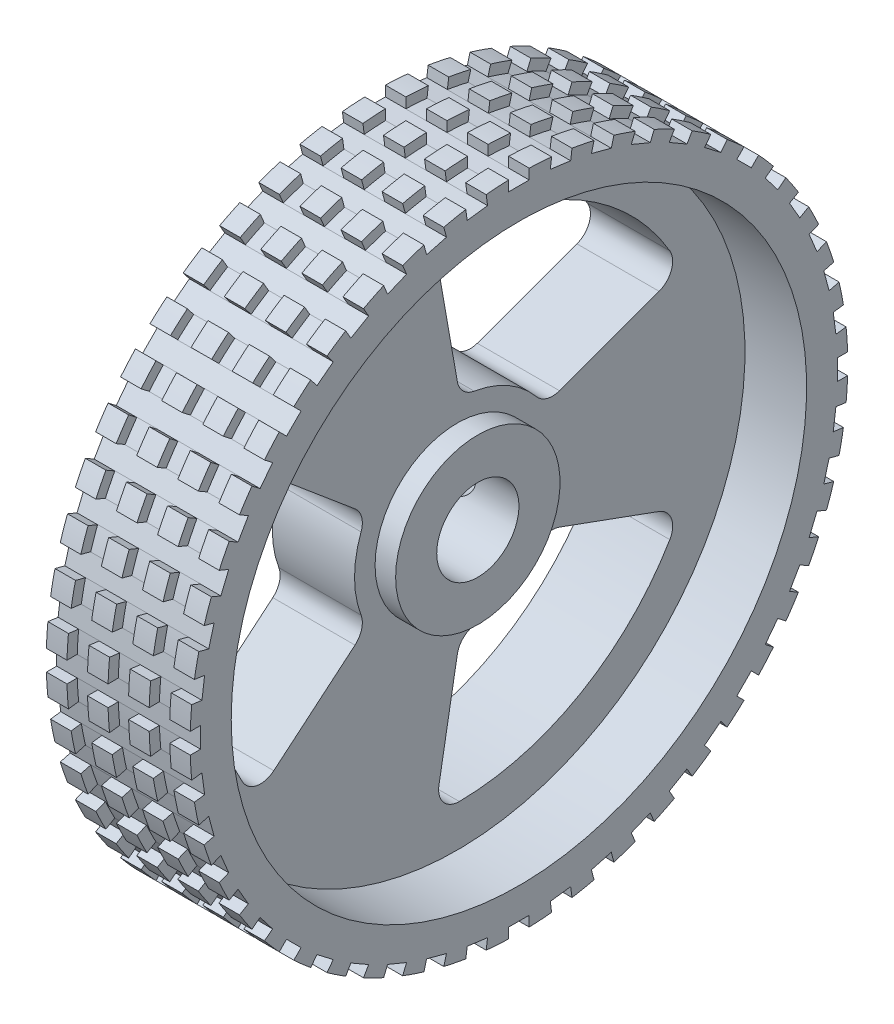
from build123d import *

# Parameters (mm, degrees)
CUT_EXTRUDE1_DEPTH       = 23.978250743
FILLET1_R                = 1
CIRPATTERN1_COUNT        = 3
FILLET1_OF_CIRPATTERN1_R = 1
SKETCH5_W                = 1
SKETCH5_H                = 0.5
SKETCH8_W                = 0.5
SKETCH8_H                = 1
CUT_EXTRUDE8_DEPTH       = 24.685438729
CIRPATTERN2_DEPTH        = 7
LPATTERN1_COUNT          = 3
LPATTERN1_PITCH          = 2


# Read off the part's stored shape, not the designer's step: CirPattern2
with BuildPart() as part:
    # Sketch1 → Revolve1 (revolve)
    with BuildSketch(Plane(origin=(0, 0, 0), x_dir=(1, 0, 0), z_dir=(0, 1, 0)), mode=Mode.PRIVATE) as revolve1_sk:
        Polygon((0, 16), (7, 16), (7, 14), (4, 14), (4, 4), (5, 4), (5, 2), (0, 2), align=None)
    revolve(revolve1_sk.sketch.rotate(Axis((0, 0, 0), (1, 0, 0)), 180), axis=Axis((0, 0, 0), (1, 0, 0)))

    # Sketch3 → countersunk (revolve, cut)
    with BuildSketch(Plane(origin=(0, 0, 0), x_dir=(1, 0, 0), z_dir=(0, 1, 0))):
        Polygon((2, 16), (3.5, 16), (3.5, 11.5), (2.9, 11.5), (2.9, 0), (2, 0), align=None)
    revolve(axis=Axis((2, 0, 1.061944764), (0, 0, -1)), mode=Mode.SUBTRACT)

    # Sketch4 → Cut-Extrude1 (cut, through all)
    with BuildSketch(Plane(origin=(4, 0, 0), x_dir=(0, 0, -1), z_dir=(1, 0, 0))):
        with BuildLine():
            Line((-1.091722433, 11.95023607), (0.134108893, 4.998201157))
            ThreePointArc((0.134108893, 4.998201157), (2.5, 4.330127019), (4.261514729, 2.615242287))
            Line((4.261514729, 2.615242287), (10.895069234, 5.029658674))
            ThreePointArc((10.895069234, 5.029658674), (6, 10.392304845), (-1.091722433, 11.95023607))
        make_face()
    cut_extrude1 = extrude(amount=-CUT_EXTRUDE1_DEPTH, mode=Mode.SUBTRACT)

    # Fillet1
    fillet1_edges = [part.edges().sort_by_distance(p)[0] for p in [
        (2, 11.95023607, 1.091722433),
        (2, 5.029658674, -10.895069234),
        (2, 2.615242287, -4.261514729),
        (2, 4.998201157, -0.134108893),
    ]]
    fillet(fillet1_edges, radius=FILLET1_R)

    # CirPattern1: Cut-Extrude1 ×3 about axis
    cirpattern1_axis = Axis((0, 0, 0), (1, 0, 0))
    for i in range(1, CIRPATTERN1_COUNT):
        add(cut_extrude1.rotate(cirpattern1_axis, i * 360 / CIRPATTERN1_COUNT), mode=Mode.SUBTRACT)

    # Fillet1 of CirPattern1
    fillet1_of_cirpattern1_edges = [part.edges().sort_by_distance(p)[0] for p in [
        (2, -6.920577396, 9.803346801),
        (2, 6.920577396, 9.803346801),
        (2, 2.38295887, 4.395623622),
        (2, -2.38295887, 4.395623622),
        (2, -5.029658674, -10.895069234),
        (2, -11.95023607, 1.091722433),
        (2, -4.998201157, -0.134108893),
        (2, -2.615242287, -4.261514729),
    ]]
    fillet(fillet1_of_cirpattern1_edges, radius=FILLET1_OF_CIRPATTERN1_R)

    # Sketch5 → Cut-Revolve1 (revolve, cut)
    with BuildSketch(Plane(origin=(0, 0, 0), x_dir=(1, 0, 0), z_dir=(0, 1, 0)), mode=Mode.PRIVATE) as cut_revolve1_sk:
        with Locations((5.5, 15.75)):
            Rectangle(SKETCH5_W, SKETCH5_H)
    cut_revolve1 = revolve(cut_revolve1_sk.sketch.rotate(Axis((0, 0, 0), (1, 0, 0)), 180), axis=Axis((0, 0, 0), (1, 0, 0)), mode=Mode.SUBTRACT)

    # Sketch8 → Cut-Extrude8 (cut, through all)
    with BuildSketch(Plane(origin=(7, 0, 0), x_dir=(0, 0, -1), z_dir=(1, 0, 0))):
        with Locations((15.742185592, 0)):
            Rectangle(SKETCH8_W, SKETCH8_H)
    extrude(amount=-CUT_EXTRUDE8_DEPTH, mode=Mode.SUBTRACT)


with BuildPart() as cut_extrude8_kept_piece:
    # of the separate pieces the step leaves, the one the design keeps (cut_extrude8_pieces_kept)
    add(part.part.solids().sort_by_distance((0, 0.5, -15.492185592))[0])

    # CirPattern2 outline → CirPattern2 (cut)
    with BuildSketch(Plane.YZ):
        with BuildLine():
            Line((0.5, 15.492185592), (0.5, 15.992185592))
            ThreePointArc((0.5, 15.992185592), (0, 16), (-0.5, 15.992185592))
            Line((-0.5, 15.992185592), (-0.5, 15.492185592))
            Line((-0.5, 15.492185592), (0.5, 15.492185592))
        make_face()
        with BuildLine():
            ThreePointArc((2.583121521, 15.790107132), (2.088419076, 15.863117783), (1.59167666, 15.920633324))
            Line((1.59167666, 15.920633324), (1.526413564, 15.424910892))
            Line((1.526413564, 15.424910892), (2.517858425, 15.2943847))
            Line((2.517858425, 15.2943847), (2.583121521, 15.790107132))
        make_face()
        with BuildLine():
            Line((-1.526413564, 15.424910892), (-1.59167666, 15.920633323))
            ThreePointArc((-1.59167666, 15.920633323), (-2.088419075, 15.863117781), (-2.583121521, 15.79010713))
            Line((-2.583121521, 15.79010713), (-2.517858425, 15.2943847))
            Line((-2.517858425, 15.2943847), (-1.526413564, 15.424910892))
        make_face()
        with BuildLine():
            ThreePointArc((4.622045117, 15.317855561), (4.141104722, 15.454813222), (3.656119291, 15.576674605))
            Line((3.656119291, 15.576674605), (3.526709768, 15.093711691))
            Line((3.526709768, 15.093711691), (4.492635595, 14.834892646))
            Line((4.492635595, 14.834892646), (4.622045117, 15.317855561))
        make_face()
        with BuildLine():
            Line((-3.526709768, 15.093711691), (-3.656119291, 15.576674603))
            ThreePointArc((-3.656119291, 15.576674603), (-4.141104721, 15.454813219), (-4.622045117, 15.317855558))
            Line((-4.622045117, 15.317855558), (-4.492635595, 14.834892646))
            Line((-4.492635595, 14.834892646), (-3.526709768, 15.093711691))
        make_face()
        with BuildLine():
            ThreePointArc((6.581884241, 14.583511234), (6.122934919, 14.782072522), (5.658004708, 14.966194666))
            Line((5.658004708, 14.966194666), (5.466662991, 14.504254898))
            Line((5.466662991, 14.504254898), (6.390542523, 14.121571466))
            Line((6.390542523, 14.121571466), (6.581884241, 14.583511234))
        make_face()
        with BuildLine():
            Line((-5.466662991, 14.504254898), (-5.658004707, 14.966194663))
            ThreePointArc((-5.658004707, 14.966194663), (-6.122934917, 14.782072518), (-6.581884239, 14.58351123))
            Line((-6.581884239, 14.58351123), (-6.390542523, 14.121571466))
            Line((-6.390542523, 14.121571466), (-5.466662991, 14.504254898))
        make_face()
        with BuildLine():
            ThreePointArc((8.429105499, 13.599638986), (8.000000001, 13.856406462), (7.563080095, 14.099638986))
            Line((7.563080095, 14.099638986), (7.313080094, 13.666626283))
            Line((7.313080094, 13.666626283), (8.179105498, 13.166626283))
            Line((8.179105498, 13.166626283), (8.429105499, 13.599638986))
        make_face()
        with BuildLine():
            Line((-7.313080094, 13.666626283), (-7.563080093, 14.099638982))
            ThreePointArc((-7.563080093, 14.099638982), (-7.999999999, 13.856406458), (-8.429105497, 13.599638982))
            Line((-8.429105497, 13.599638982), (-8.179105498, 13.166626283))
            Line((-8.179105498, 13.166626283), (-7.313080094, 13.666626283))
        make_face()
        with BuildLine():
            ThreePointArc((10.132102426, 12.383073145), (9.740182866, 12.693653447), (9.338749086, 12.991834574))
            Line((9.338749086, 12.991834574), (9.034368369, 12.595157902))
            Line((9.034368369, 12.595157902), (9.827721709, 11.986396473))
            Line((9.827721709, 11.986396473), (10.132102426, 12.383073145))
        make_face()
        with BuildLine():
            Line((-9.034368369, 12.595157902), (-9.338749082, 12.99183457))
            ThreePointArc((-9.338749082, 12.99183457), (-9.740182863, 12.693653442), (-10.132102422, 12.383073141))
            Line((-10.132102422, 12.383073141), (-9.827721709, 11.986396473))
            Line((-9.827721709, 11.986396473), (-9.034368369, 12.595157902))
        make_face()
        with BuildLine():
            ThreePointArc((11.661736271, 10.95462949), (11.313708501, 11.313708501), (10.95462949, 11.661736271))
            Line((10.95462949, 11.661736271), (10.601076097, 11.308182878))
            Line((10.601076097, 11.308182878), (11.308182878, 10.601076097))
            Line((11.308182878, 10.601076097), (11.661736271, 10.95462949))
        make_face()
        with BuildLine():
            Line((-10.601076097, 11.308182878), (-10.954629485, 11.661736266))
            ThreePointArc((-10.954629485, 11.661736266), (-11.313708497, 11.313708497), (-11.661736266, 10.954629485))
            Line((-11.661736266, 10.954629485), (-11.308182878, 10.601076097))
            Line((-11.308182878, 10.601076097), (-10.601076097, 11.308182878))
        make_face()
        with BuildLine():
            ThreePointArc((12.991834575, 9.338749086), (12.693653447, 9.740182867), (12.383073146, 10.132102426))
            Line((12.383073146, 10.132102426), (11.986396473, 9.827721709))
            Line((11.986396473, 9.827721709), (12.595157902, 9.034368369))
            Line((12.595157902, 9.034368369), (12.991834575, 9.338749086))
        make_face()
        with BuildLine():
            Line((-11.986396473, 9.827721709), (-12.38307314, 10.132102422))
            ThreePointArc((-12.38307314, 10.132102422), (-12.693653442, 9.740182862), (-12.991834569, 9.338749082))
            Line((-12.991834569, 9.338749082), (-12.595157902, 9.034368369))
            Line((-12.595157902, 9.034368369), (-11.986396473, 9.827721709))
        make_face()
        with BuildLine():
            ThreePointArc((14.099638988, 7.563080096), (13.856406464, 8.000000002), (13.599638988, 8.4291055))
            Line((13.599638988, 8.4291055), (13.166626283, 8.179105498))
            Line((13.166626283, 8.179105498), (13.666626283, 7.313080094))
            Line((13.666626283, 7.313080094), (14.099638988, 7.563080096))
        make_face()
        with BuildLine():
            Line((-13.166626283, 8.179105498), (-13.599638981, 8.429105496))
            ThreePointArc((-13.599638981, 8.429105496), (-13.856406457, 7.999999998), (-14.099638981, 7.563080092))
            Line((-14.099638981, 7.563080092), (-13.666626283, 7.313080094))
            Line((-13.666626283, 7.313080094), (-13.166626283, 8.179105498))
        make_face()
        with BuildLine():
            ThreePointArc((14.966194668, 5.658004709), (14.782072524, 6.12293492), (14.583511236, 6.581884242))
            Line((14.583511236, 6.581884242), (14.121571466, 6.390542523))
            Line((14.121571466, 6.390542523), (14.504254898, 5.466662991))
            Line((14.504254898, 5.466662991), (14.966194668, 5.658004709))
        make_face()
        with BuildLine():
            Line((-14.121571466, 6.390542523), (-14.583511228, 6.581884238))
            ThreePointArc((-14.583511228, 6.581884238), (-14.782072516, 6.122934916), (-14.96619466, 5.658004706))
            Line((-14.96619466, 5.658004706), (-14.504254898, 5.466662991))
            Line((-14.504254898, 5.466662991), (-14.121571466, 6.390542523))
        make_face()
        with BuildLine():
            ThreePointArc((15.576674609, 3.656119292), (15.454813225, 4.141104723), (15.317855564, 4.622045118))
            Line((15.317855564, 4.622045118), (14.834892646, 4.492635595))
            Line((14.834892646, 4.492635595), (15.093711691, 3.526709768))
            Line((15.093711691, 3.526709768), (15.576674609, 3.656119292))
        make_face()
        with BuildLine():
            Line((-14.834892646, 4.492635595), (-15.317855555, 4.622045116))
            ThreePointArc((-15.317855555, 4.622045116), (-15.454813216, 4.141104721), (-15.5766746, 3.65611929))
            Line((-15.5766746, 3.65611929), (-15.093711691, 3.526709768))
            Line((-15.093711691, 3.526709768), (-14.834892646, 4.492635595))
        make_face()
        with BuildLine():
            ThreePointArc((15.920633328, 1.59167666), (15.863117786, 2.088419076), (15.790107135, 2.583121522))
            Line((15.790107135, 2.583121522), (15.2943847, 2.517858425))
            Line((15.2943847, 2.517858425), (15.424910892, 1.526413564))
            Line((15.424910892, 1.526413564), (15.920633328, 1.59167666))
        make_face()
        with BuildLine():
            Line((-15.2943847, 2.517858425), (-15.790107126, 2.58312152))
            ThreePointArc((-15.790107126, 2.58312152), (-15.863117777, 2.088419075), (-15.920633318, 1.59167666))
            Line((-15.920633318, 1.59167666), (-15.424910892, 1.526413564))
            Line((-15.424910892, 1.526413564), (-15.2943847, 2.517858425))
        make_face()
        with BuildLine():
            ThreePointArc((15.992185596, -0.5), (16.000000005, 0), (15.992185596, 0.5))
            Line((15.992185596, 0.5), (15.492185592, 0.5))
            Line((15.492185592, 0.5), (15.492185592, -0.5))
            Line((15.492185592, -0.5), (15.992185596, -0.5))
        make_face()
        with BuildLine():
            Line((-15.492185592, 0.5), (-15.992185587, 0.5))
            ThreePointArc((-15.992185587, 0.5), (-15.999999995, 0), (-15.992185587, -0.5))
            Line((-15.992185587, -0.5), (-15.492185592, -0.5))
            Line((-15.492185592, -0.5), (-15.492185592, 0.5))
        make_face()
        with BuildLine():
            ThreePointArc((15.790107135, -2.583121522), (15.863117786, -2.088419076), (15.920633328, -1.59167666))
            Line((15.920633328, -1.59167666), (15.424910892, -1.526413564))
            Line((15.424910892, -1.526413564), (15.2943847, -2.517858425))
            Line((15.2943847, -2.517858425), (15.790107135, -2.583121522))
        make_face()
        with BuildLine():
            Line((-15.424910892, -1.526413564), (-15.920633318, -1.59167666))
            ThreePointArc((-15.920633318, -1.59167666), (-15.863117777, -2.088419075), (-15.790107126, -2.58312152))
            Line((-15.790107126, -2.58312152), (-15.2943847, -2.517858425))
            Line((-15.2943847, -2.517858425), (-15.424910892, -1.526413564))
        make_face()
        with BuildLine():
            ThreePointArc((15.317855563, -4.622045118), (15.454813225, -4.141104723), (15.576674609, -3.656119292))
            Line((15.576674609, -3.656119292), (15.093711691, -3.526709768))
            Line((15.093711691, -3.526709768), (14.834892646, -4.492635595))
            Line((14.834892646, -4.492635595), (15.317855563, -4.622045118))
        make_face()
        with BuildLine():
            Line((-15.093711691, -3.526709768), (-15.5766746, -3.65611929))
            ThreePointArc((-15.5766746, -3.65611929), (-15.454813216, -4.141104721), (-15.317855555, -4.622045116))
            Line((-15.317855555, -4.622045116), (-14.834892646, -4.492635595))
            Line((-14.834892646, -4.492635595), (-15.093711691, -3.526709768))
        make_face()
        with BuildLine():
            ThreePointArc((14.583511236, -6.581884242), (14.782072524, -6.12293492), (14.966194668, -5.658004709))
            Line((14.966194668, -5.658004709), (14.504254898, -5.466662991))
            Line((14.504254898, -5.466662991), (14.121571466, -6.390542523))
            Line((14.121571466, -6.390542523), (14.583511236, -6.581884242))
        make_face()
        with BuildLine():
            Line((-14.504254898, -5.466662991), (-14.96619466, -5.658004706))
            ThreePointArc((-14.96619466, -5.658004706), (-14.782072516, -6.122934916), (-14.583511228, -6.581884238))
            Line((-14.583511228, -6.581884238), (-14.121571466, -6.390542523))
            Line((-14.121571466, -6.390542523), (-14.504254898, -5.466662991))
        make_face()
        with BuildLine():
            ThreePointArc((13.599638987, -8.4291055), (13.856406464, -8.000000002), (14.099638988, -7.563080096))
            Line((14.099638988, -7.563080096), (13.666626283, -7.313080094))
            Line((13.666626283, -7.313080094), (13.166626283, -8.179105498))
            Line((13.166626283, -8.179105498), (13.599638987, -8.4291055))
        make_face()
        with BuildLine():
            Line((-13.666626283, -7.313080094), (-14.099638981, -7.563080092))
            ThreePointArc((-14.099638981, -7.563080092), (-13.856406457, -7.999999998), (-13.599638981, -8.429105496))
            Line((-13.599638981, -8.429105496), (-13.166626283, -8.179105498))
            Line((-13.166626283, -8.179105498), (-13.666626283, -7.313080094))
        make_face()
        with BuildLine():
            ThreePointArc((12.383073146, -10.132102426), (12.693653447, -9.740182867), (12.991834575, -9.338749086))
            Line((12.991834575, -9.338749086), (12.595157902, -9.034368369))
            Line((12.595157902, -9.034368369), (11.986396473, -9.827721709))
            Line((11.986396473, -9.827721709), (12.383073146, -10.132102426))
        make_face()
        with BuildLine():
            Line((-12.595157902, -9.034368369), (-12.991834569, -9.338749082))
            ThreePointArc((-12.991834569, -9.338749082), (-12.693653441, -9.740182862), (-12.38307314, -10.132102422))
            Line((-12.38307314, -10.132102422), (-11.986396473, -9.827721709))
            Line((-11.986396473, -9.827721709), (-12.595157902, -9.034368369))
        make_face()
        with BuildLine():
            ThreePointArc((10.954629489, -11.661736271), (11.313708501, -11.313708501), (11.661736271, -10.95462949))
            Line((11.661736271, -10.95462949), (11.308182878, -10.601076097))
            Line((11.308182878, -10.601076097), (10.601076097, -11.308182878))
            Line((10.601076097, -11.308182878), (10.954629489, -11.661736271))
        make_face()
        with BuildLine():
            Line((-11.308182878, -10.601076097), (-11.661736266, -10.954629485))
            ThreePointArc((-11.661736266, -10.954629485), (-11.313708497, -11.313708497), (-10.954629485, -11.661736266))
            Line((-10.954629485, -11.661736266), (-10.601076097, -11.308182878))
            Line((-10.601076097, -11.308182878), (-11.308182878, -10.601076097))
        make_face()
        with BuildLine():
            ThreePointArc((9.338749086, -12.991834574), (9.740182866, -12.693653447), (10.132102426, -12.383073145))
            Line((10.132102426, -12.383073145), (9.827721709, -11.986396473))
            Line((9.827721709, -11.986396473), (9.034368369, -12.595157902))
            Line((9.034368369, -12.595157902), (9.338749086, -12.991834574))
        make_face()
        with BuildLine():
            Line((-9.827721709, -11.986396473), (-10.132102422, -12.383073141))
            ThreePointArc((-10.132102422, -12.383073141), (-9.740182863, -12.693653442), (-9.338749082, -12.99183457))
            Line((-9.338749082, -12.99183457), (-9.034368369, -12.595157902))
            Line((-9.034368369, -12.595157902), (-9.827721709, -11.986396473))
        make_face()
        with BuildLine():
            ThreePointArc((7.563080095, -14.099638986), (8.000000001, -13.856406462), (8.429105499, -13.599638986))
            Line((8.429105499, -13.599638986), (8.179105498, -13.166626283))
            Line((8.179105498, -13.166626283), (7.313080094, -13.666626283))
            Line((7.313080094, -13.666626283), (7.563080095, -14.099638986))
        make_face()
        with BuildLine():
            Line((-8.179105498, -13.166626283), (-8.429105497, -13.599638982))
            ThreePointArc((-8.429105497, -13.599638982), (-7.999999999, -13.856406458), (-7.563080093, -14.099638982))
            Line((-7.563080093, -14.099638982), (-7.313080094, -13.666626283))
            Line((-7.313080094, -13.666626283), (-8.179105498, -13.166626283))
        make_face()
        with BuildLine():
            ThreePointArc((5.658004708, -14.966194666), (6.122934919, -14.782072522), (6.581884241, -14.583511234))
            Line((6.581884241, -14.583511234), (6.390542523, -14.121571466))
            Line((6.390542523, -14.121571466), (5.466662991, -14.504254898))
            Line((5.466662991, -14.504254898), (5.658004708, -14.966194666))
        make_face()
        with BuildLine():
            Line((-6.390542523, -14.121571466), (-6.581884239, -14.58351123))
            ThreePointArc((-6.581884239, -14.58351123), (-6.122934917, -14.782072518), (-5.658004707, -14.966194663))
            Line((-5.658004707, -14.966194663), (-5.466662991, -14.504254898))
            Line((-5.466662991, -14.504254898), (-6.390542523, -14.121571466))
        make_face()
        with BuildLine():
            ThreePointArc((3.656119291, -15.576674605), (4.141104722, -15.454813222), (4.622045117, -15.31785556))
            Line((4.622045117, -15.31785556), (4.492635595, -14.834892646))
            Line((4.492635595, -14.834892646), (3.526709768, -15.093711691))
            Line((3.526709768, -15.093711691), (3.656119291, -15.576674605))
        make_face()
        with BuildLine():
            Line((-4.492635595, -14.834892646), (-4.622045117, -15.317855558))
            ThreePointArc((-4.622045117, -15.317855558), (-4.141104721, -15.454813219), (-3.656119291, -15.576674603))
            Line((-3.656119291, -15.576674603), (-3.526709768, -15.093711691))
            Line((-3.526709768, -15.093711691), (-4.492635595, -14.834892646))
        make_face()
        with BuildLine():
            ThreePointArc((1.59167666, -15.920633323), (2.088419076, -15.863117782), (2.583121521, -15.790107132))
            Line((2.583121521, -15.790107132), (2.517858425, -15.2943847))
            Line((2.517858425, -15.2943847), (1.526413564, -15.424910892))
            Line((1.526413564, -15.424910892), (1.59167666, -15.920633323))
        make_face()
        with BuildLine():
            Line((-2.517858425, -15.2943847), (-2.583121521, -15.79010713))
            ThreePointArc((-2.583121521, -15.79010713), (-2.088419075, -15.863117781), (-1.59167666, -15.920633323))
            Line((-1.59167666, -15.920633323), (-1.526413564, -15.424910892))
            Line((-1.526413564, -15.424910892), (-2.517858425, -15.2943847))
        make_face()
    extrude(amount=CIRPATTERN2_DEPTH, mode=Mode.SUBTRACT)

    # LPattern1: Cut-Revolve1 ×3
    with Locations(*[(-i * LPATTERN1_PITCH, 0, 0) for i in range(1, LPATTERN1_COUNT)]):
        add(cut_revolve1, mode=Mode.SUBTRACT)


solid = cut_extrude8_kept_piece.part
